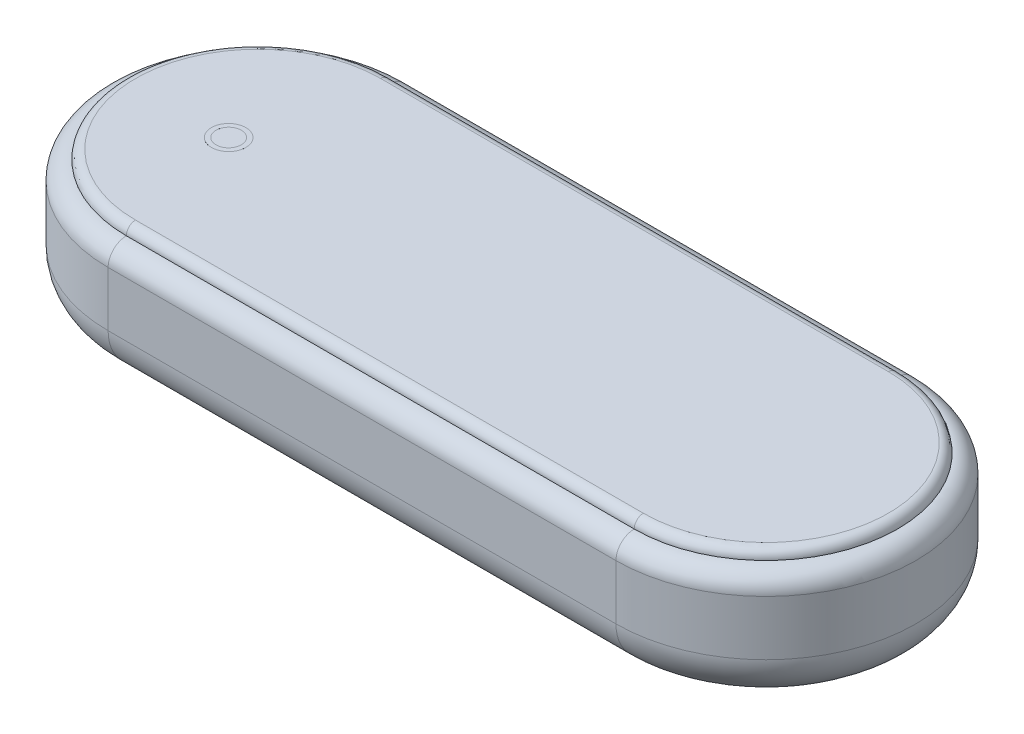
from build123d import *

# Parameters (mm, degrees)
BOSS_EXTRUDE1_DEPTH = 13
FILLET1_R           = 2
BOSS_EXTRUDE2_DEPTH = 1
FILLET2_R           = 1
FILLET3_R           = 5
BOSS_EXTRUDE3_DEPTH = 1
FILLET4_R           = 0.5
SKETCH4_W           = 1.174042857
SKETCH4_H           = 1.277967626
SKETCH4_W_2         = 1.113508224
BOSS_EXTRUDE4_DEPTH = 0.1
FILLET5_R           = 0.5
FILLET6_R           = 0.5
SKETCH5_W           = 2.340411645
SKETCH5_H           = 2.629602796
BOSS_EXTRUDE5_DEPTH = 0.2
SKETCH6_W           = 2.034265593
SKETCH6_H           = 2.21497745
CUT_EXTRUDE1_DEPTH  = 0.1
CUT_EXTRUDE2_DEPTH  = 0.1
FILLET7_R           = 0.5
SKETCH9_R           = 0.50461609
BOSS_EXTRUDE6_DEPTH = 0.1
SKETCH14_R          = 1.886920972
SKETCH14_R_2        = 1.386920972
BOSS_EXTRUDE7_DEPTH = 0.001


# Some blends are built 0.0001 mm under size
with BuildPart() as part:
    # Sketch1 → Boss-Extrude1 (new body)
    with BuildSketch(Plane(origin=(0, 0, 0), x_dir=(1, 0, 0), z_dir=(0, 1, 0))):
        with BuildLine():
            Line((0, -16.426551001), (-55.627881437, -16.426551001))
            ThreePointArc((-55.627881437, -16.426551001), (-72.054432439, 0), (-55.627881437, 16.426551001))
            Line((-55.627881437, 16.426551001), (0, 16.426551001))
            ThreePointArc((0, 16.426551001), (16.426551001, 0), (0, -16.426551001))
        make_face()
    extrude(amount=BOSS_EXTRUDE1_DEPTH)

    # Fillet1
    fillet1_edges = [part.edges().sort_by_distance(p)[0] for p in [
        (-72.054432439, 13, 0),
        (-27.813940719, 13, 16.426551001),
        (16.426551001, 13, 0),
        (-27.813940719, 13, -16.426551001),
    ]]
    fillet(fillet1_edges, radius=FILLET1_R)

    # Sketch2 → Boss-Extrude2 (add)
    with BuildSketch(Plane(origin=(0, 13, 0), x_dir=(1, 0, 0), z_dir=(0, 1, 0))):
        with BuildLine():
            Line((0, 14.426551001), (-55.627881437, 14.426551001))
            ThreePointArc((-55.627881437, 14.426551001), (-70.054432439, 0), (-55.627881437, -14.426551001))
            Line((-55.627881437, -14.426551001), (0, -14.426551001))
            ThreePointArc((0, -14.426551001), (14.426551001, 0), (0, 14.426551001))
        make_face()
    extrude(amount=BOSS_EXTRUDE2_DEPTH)

    # Fillet2
    fillet2_edges = [part.edges().sort_by_distance(p)[0] for p in [
        (-70.054432439, 14, 0),
        (-27.813940719, 14, -14.426551001),
        (14.426551001, 14, 0),
        (-27.813940719, 14, 14.426551001),
    ]]
    fillet(fillet2_edges, radius=FILLET2_R - 0.0001)  # a hair under: the kernel refuses the full size

    # Fillet3
    fillet3_edges = [part.edges().sort_by_distance(p)[0] for p in [
        (-27.813940719, 0, 16.426551001),
        (-72.054432439, 0, 0),
        (-27.813940719, 0, -16.426551001),
        (16.426551001, 0, 0),
    ]]
    fillet(fillet3_edges, radius=FILLET3_R)

    # Sketch3 → Boss-Extrude3 (add)
    with BuildSketch(Plane.XZ):
        with BuildLine():
            Line((-31.270313728, 4.445393379), (-22.846002165, 4.445393379))
            ThreePointArc((-22.846002165, 4.445393379), (-18.400608786, 0), (-22.846002165, -4.445393379))
            Line((-22.846002165, -4.445393379), (-31.270313728, -4.445393379))
            ThreePointArc((-31.270313728, -4.445393379), (-35.715707107, 0), (-31.270313728, 4.445393379))
        make_face()
    extrude(amount=BOSS_EXTRUDE3_DEPTH)

    # Fillet4
    fillet4_edges = [part.edges().sort_by_distance(p)[0] for p in [
        (-35.715707107, 0, 0),
        (-27.058157947, 0, -4.445393379),
        (-18.400608786, 0, 0),
        (-27.058157947, 0, 4.445393379),
    ]]
    fillet(fillet4_edges, radius=FILLET4_R)

    # Sketch4 → Boss-Extrude4 (add)
    with BuildSketch(Plane.XZ.offset(1)):
        with BuildLine():
            Line((-31.270313728, -3.445393379), (-22.846002165, -3.445393379))
            ThreePointArc((-22.846002165, -3.445393379), (-19.400608786, 0), (-22.846002165, 3.445393379))
            Line((-22.846002165, 3.445393379), (-31.270313728, 3.445393379))
            ThreePointArc((-31.270313728, 3.445393379), (-34.715707107, 0), (-31.270313728, -3.445393379))
        make_face()
        with Locations((-22.846002166, 0)):
            Rectangle(SKETCH4_W, SKETCH4_H, mode=Mode.SUBTRACT)
        with Locations((-31.270313728, 0)):
            Rectangle(SKETCH4_W_2, SKETCH4_H, mode=Mode.SUBTRACT)
    extrude(amount=BOSS_EXTRUDE4_DEPTH)

    # Fillet5
    # the kernel refuses this fillet: 0.5 mm, written as the material it takes off along each edge
    with BuildSketch(Plane(origin=(-22.846002165, -1.1, 0), x_dir=(0, 0, -1), z_dir=(-1, 0, 0))) as fillet5_piece_1:
        with BuildLine():
            CenterArc((3.145393379, -0.5), FILLET5_R, 53.130102354, 36.869897646)
            Line((3.145393379, 0), (3.145393379, 0.01))
            Line((3.145393379, 0.01), (3.445393379, 0.01))
            Line((3.445393379, 0.01), (3.455393379, 0))
            ThreePointArc((3.455393379, 0), (3.455393379, -0.05), (3.451393379, -0.092))
            Line((3.451393379, -0.092), (3.445393379, -0.1))
        make_face()
    revolve(axis=Axis((-22.846002165, -1.1, 0), (0, -1, 0)), revolution_arc=180, mode=Mode.SUBTRACT)
    with BuildSketch(Plane(origin=(-31.270313728, -1.1, -3.445393379), x_dir=(0, 1, 0), z_dir=(1, 0, 0)), Plane(origin=(-22.846002165, -1.1, 3.445393379), x_dir=(0, 1, 0), z_dir=(-1, 0, 0))) as fillet5_piece_2:
        with BuildLine():
            CenterArc((0.5, 0.3), FILLET5_R, 180, 36.869897646)
            Line((0, 0.3), (-0.01, 0.3))
            Line((-0.01, 0.3), (-0.01, 0))
            Line((-0.01, 0), (0, -0.01))
            ThreePointArc((0, -0.01), (0.05, -0.01), (0.092, -0.006))
            Line((0.092, -0.006), (0.1, 0))
        make_face()
    extrude(amount=8.424311563, mode=Mode.SUBTRACT)
    with BuildSketch(Plane(origin=(-31.270313728, -1.1, 0), x_dir=(0, 0, 1), z_dir=(1, 0, 0))) as fillet5_piece_3:
        with BuildLine():
            CenterArc((3.145393379, -0.5), FILLET5_R, 53.130102354, 36.869897646)
            Line((3.145393379, 0), (3.145393379, 0.01))
            Line((3.145393379, 0.01), (3.445393379, 0.01))
            Line((3.445393379, 0.01), (3.455393379, 0))
            ThreePointArc((3.455393379, 0), (3.455393379, -0.05), (3.451393379, -0.092))
            Line((3.451393379, -0.092), (3.445393379, -0.1))
        make_face()
    revolve(axis=Axis((-31.270313728, -1.1, 0), (0, -1, 0)), revolution_arc=180, mode=Mode.SUBTRACT)

    # Fillet6
    fillet6_edges = [part.edges().sort_by_distance(p)[0] for p in [
        (-18.400608786, -1, 0),
        (-27.058157947, -1, -4.445393379),
        (-35.715707107, -1, 0),
        (-27.058157947, -1, 4.445393379),
    ]]
    fillet(fillet6_edges, radius=FILLET6_R - 0.0001)  # a hair under: the kernel refuses the full size

    # Sketch5 → Boss-Extrude5 (add)
    with BuildSketch(Plane.XZ.offset(1.1)):
        with Locations((-27.058157947, 0)):
            Rectangle(SKETCH5_W, SKETCH5_H)
    extrude(amount=-BOSS_EXTRUDE5_DEPTH)

    # Sketch6 → Cut-Extrude1 (cut)
    with BuildSketch(Plane.XZ.offset(1.1)):
        with Locations((-27.058157947, 0)):
            Rectangle(SKETCH6_W, SKETCH6_H)
    extrude(amount=-CUT_EXTRUDE1_DEPTH, mode=Mode.SUBTRACT)

    # Sketch7 → Cut-Extrude2 (cut)
    with BuildSketch(Plane.XZ):
        with BuildLine():
            Line((-53.564486161, 1.248163032), (-53.564486161, -1.254534769))
            ThreePointArc((-53.564486161, -1.254534769), (-54.596183799, -2.286232407), (-55.627881437, -1.254534769))
            Line((-55.627881437, -1.254534769), (-55.627881437, 1.248163032))
            ThreePointArc((-55.627881437, 1.248163032), (-54.596183799, 2.27986067), (-53.564486161, 1.248163032))
        make_face()
    extrude(amount=-CUT_EXTRUDE2_DEPTH, mode=Mode.SUBTRACT)

    # Fillet7
    # the kernel refuses this fillet: 0.5 mm, written as the material it adds along each edge
    with BuildSketch(Plane(origin=(-55.627881437, 0.1, -1.254534769), x_dir=(0, -1, 0), z_dir=(0, 0, 1)), Plane(origin=(-53.564486161, 0.1, 1.248163032), x_dir=(0, -1, 0), z_dir=(0, 0, -1))) as fillet7_piece_1:
        with BuildLine():
            CenterArc((0.5, 0.3), FILLET7_R, 180, 36.869897646)
            Line((0, 0.3), (-0.01, 0.3))
            Line((-0.01, 0.3), (-0.01, 0))
            Line((-0.01, 0), (0, -0.01))
            ThreePointArc((0, -0.01), (0.05, -0.01), (0.092, -0.006))
            Line((0.092, -0.006), (0.1, 0))
        make_face()
    extrude(amount=2.502697801)
    with BuildSketch(Plane(origin=(-54.596183799, 0.1, -1.254534769), x_dir=(1, 0, 0), z_dir=(0, 0, 1))) as fillet7_piece_2:
        with BuildLine():
            CenterArc((0.731697638, -0.5), FILLET7_R, 53.130102354, 36.869897646)
            Line((0.731697638, 0), (0.731697638, 0.01))
            Line((0.731697638, 0.01), (1.031697638, 0.01))
            Line((1.031697638, 0.01), (1.041697638, 0))
            ThreePointArc((1.041697638, 0), (1.041697638, -0.05), (1.037697638, -0.092))
            Line((1.037697638, -0.092), (1.031697638, -0.1))
        make_face()
    revolve(axis=Axis((-54.596183799, 0.1, -1.254534769), (0, 1, 0)), revolution_arc=180)
    with BuildSketch(Plane(origin=(-54.596183799, 0.1, 1.248163032), x_dir=(-1, 0, 0), z_dir=(0, 0, -1))) as fillet7_piece_3:
        with BuildLine():
            CenterArc((0.731697638, -0.5), FILLET7_R, 53.130102354, 36.869897646)
            Line((0.731697638, 0), (0.731697638, 0.01))
            Line((0.731697638, 0.01), (1.031697638, 0.01))
            Line((1.031697638, 0.01), (1.041697638, 0))
            ThreePointArc((1.041697638, 0), (1.041697638, -0.05), (1.037697638, -0.092))
            Line((1.037697638, -0.092), (1.031697638, -0.1))
        make_face()
    revolve(axis=Axis((-54.596183799, 0.1, 1.248163032), (0, 1, 0)), revolution_arc=180)

    # Sketch9 → Boss-Extrude6 (add)
    with BuildSketch(Plane.XZ.offset(-0.1)):
        with Locations(Location((-54.596183799, 1.248163032, 0), (0, 0, 270))):
            Circle(SKETCH9_R)
        with Locations(Location((-54.581060794, -1.252231394, 0), (0, 0, 270))):
            Circle(SKETCH9_R)
    extrude(amount=BOSS_EXTRUDE6_DEPTH)

    # Sketch14 → Boss-Extrude7 (add)
    with BuildSketch(Plane(origin=(0, 14, 0), x_dir=(1, 0, 0), z_dir=(0, 1, 0))):
        with Locations(Location((-58.35175738, -0.5, 0), (0, 0, 270))):
            Circle(SKETCH14_R)
        with Locations(Location((-58.35175738, -0.5, 0), (0, 0, 270))):
            Circle(SKETCH14_R_2, mode=Mode.SUBTRACT)
    extrude(amount=BOSS_EXTRUDE7_DEPTH)


solid = part.part
